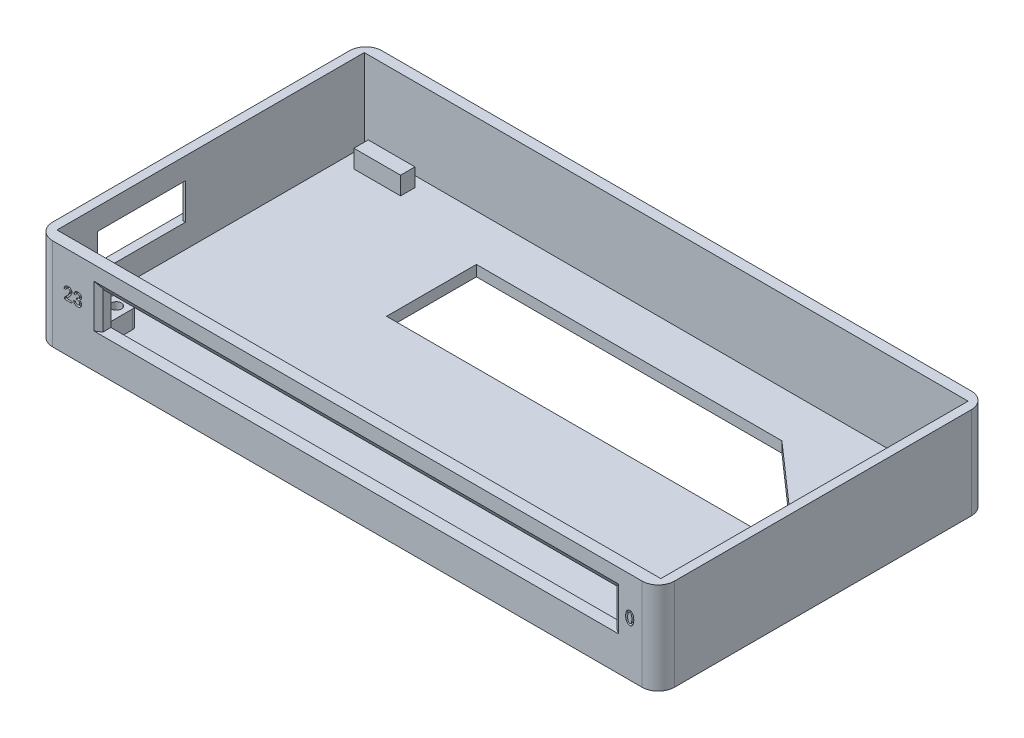
from build123d import *

# Parameters (mm, degrees)
BOSS_EXTRUDE2_DEPTH   = 4
BOSS_EXTRUDE2_2_DEPTH = 4
SKETCH3_W             = 176
SKETCH3_H             = 91.6
BOSS_EXTRUDE3_DEPTH   = 4
SKETCH6_W             = 168
SKETCH6_H             = 85.5
SKETCH6_W_2           = 160
SKETCH6_H_2           = 80
CUT_EXTRUDE2_DEPTH    = 1
SKETCH8_R             = 1.45
CUT_EXTRUDE3_DEPTH    = 100.527081742
SKETCH11_W            = 160
SKETCH11_H            = 80
CUT_EXTRUDE7_DEPTH    = 5
BOSS_EXTRUDE4_START   = 5
SKETCH12_R            = 1.45
BOSS_EXTRUDE4_DEPTH   = 5
BOSS_EXTRUDE5_START   = 5
SKETCH14_R            = 1.45
BOSS_EXTRUDE5_DEPTH   = 5
CUT_EXTRUDE8_DEPTH    = 5
SKETCH16_W            = 176
SKETCH16_H            = 91.6
SKETCH16_W_2          = 168
SKETCH16_H_2          = 85.5
BOSS_EXTRUDE6_DEPTH   = 30
FILLET2_START         = -1
FILLET2_DEPTH         = 6
SKETCH17_W            = 143
SKETCH17_H            = 10
CUT_EXTRUDE9_DEPTH    = 30
CHAMFER3_SIZE         = 1.5
CHAMFER3_SIZE2        = 0.97411139
SKETCH18_W            = 24.5
SKETCH18_H            = 10
CUT_EXTRUDE10_DEPTH   = 30
CHAMFER5_SIZE         = 1.5
CHAMFER5_SIZE2        = 0.97411139
CHAMFER6_SIZE         = 2
CHAMFER6_SIZE2        = 1.298815186
CUT_EXTRUDE11_DEPTH   = 0.6
CUT_EXTRUDE12_START   = -2.1
CUT_EXTRUDE12_DEPTH   = 3.1
SKETCH22_W            = 76
SKETCH22_H            = 3
BOSS_EXTRUDE8_DEPTH   = 20
CHAMFER7_SIZE         = 6.5
SKETCH23_R            = 1.55
CUT_EXTRUDE13_DEPTH   = 20
SKETCH26_W            = 37.191755128
SKETCH26_H            = 87.099263356
CUT_EXTRUDE14_DEPTH   = 20
SKETCH28_W            = 91.6
SKETCH28_H            = 38
CUT_EXTRUDE15_DEPTH   = 1.5
SKETCH29_W            = 91.6
SKETCH29_H            = 38
CUT_EXTRUDE16_DEPTH   = 1.5
CHAMFER8_SIZE         = 1.8
CHAMFER9_SIZE         = 1.5
FILLET3_START         = -5
FILLET3_DEPTH         = 40
CUT_EXTRUDE17_DEPTH   = 203.964948668
SKETCH30_W            = 4
SKETCH30_H            = 11
BOSS_EXTRUDE9_DEPTH   = 5
BOSS_EXTRUDE11_DEPTH  = 5
SKETCH33_W            = 13
SKETCH33_H            = 4
BOSS_EXTRUDE12_DEPTH  = 5


with BuildPart() as part:
    # Sketch2 → Boss-Extrude2 (new body)
    with BuildSketch(Plane(origin=(0, 0, 0), x_dir=(1, 0, 0), z_dir=(0, 1, 0))):
        Polygon((-80, 40), (-80, -40), (-75.05, -40), (80, -40), (80, 40), (75.05, 40), (0, 40), align=None)
        with BuildLine():
            ThreePointArc((-73.6, -35.05), (-74.024695167, -36.075304833), (-75.05, -36.5))
            ThreePointArc((-75.05, -36.5), (-76.075304833, -34.024695167), (-73.6, -35.05))
        make_face(mode=Mode.SUBTRACT)
        with BuildLine():
            ThreePointArc((76.5, 35.05), (74.024695167, 34.024695167), (75.05, 36.5))
            ThreePointArc((75.05, 36.5), (76.075304833, 36.075304833), (76.5, 35.05))
        make_face(mode=Mode.SUBTRACT)
    extrude(amount=BOSS_EXTRUDE2_DEPTH)



with BuildPart() as body_2:
    # Sketch2 → Boss-Extrude2 2 (new body)
    with BuildSketch(Plane(origin=(0, 0, 0), x_dir=(1, 0, 0), z_dir=(0, 1, 0))):
        Polygon((-88, 45.8), (-88, 40), (-88, -45.8), (-84, -45.8), (88, -45.8), (88, -40), (88, 40), (88, 45.8), (80, 45.8), align=None)
        Polygon((-84, -40), (-84, 40), (-84, 42.9), (84, 42.9), (84, -42.6), (-84, -42.6), align=None, mode=Mode.SUBTRACT)
    extrude(amount=BOSS_EXTRUDE2_2_DEPTH)


with BuildPart() as part_1:
    add(part.part)

    add(body_2.part)  # Boss-Extrude3 merges body 2
    # Sketch3 → Boss-Extrude3 (add)
    with BuildSketch(Plane(origin=(0, 0, 0), x_dir=(-1, 0, 0), z_dir=(0, -1, 0))):
        Rectangle(SKETCH3_W, SKETCH3_H)
    extrude(amount=BOSS_EXTRUDE3_DEPTH)

    # Sketch6 → Cut-Extrude2 (cut)
    with BuildSketch(Plane(origin=(0, 0, 0), x_dir=(1, 0, 0), z_dir=(0, 1, 0))):
        with Locations((0, 0.15)):
            Rectangle(SKETCH6_W, SKETCH6_H)
        Rectangle(SKETCH6_W_2, SKETCH6_H_2, mode=Mode.SUBTRACT)
    extrude(amount=-CUT_EXTRUDE2_DEPTH, mode=Mode.SUBTRACT)

    # Sketch8 → Cut-Extrude3 (cut, through all)
    with BuildSketch(Plane(origin=(0, 4, 0), x_dir=(1, 0, 0), z_dir=(0, 1, 0))):
        with Locations(Location((75.05, 35.05, 0), (0, 0, 270))):
            Circle(SKETCH8_R)
        with Locations(Location((-75.05, -35.05, 0), (0, 0, 270))):
            Circle(SKETCH8_R)
    extrude(amount=-CUT_EXTRUDE3_DEPTH, mode=Mode.SUBTRACT)

    # Sketch11 → Cut-Extrude7 (cut)
    with BuildSketch(Plane(origin=(0, 4, 0), x_dir=(1, 0, 0), z_dir=(0, 1, 0))):
        Rectangle(SKETCH11_W, SKETCH11_H)
    extrude(amount=-CUT_EXTRUDE7_DEPTH, mode=Mode.SUBTRACT)

    # Sketch12 → Boss-Extrude4 (add)
    with BuildSketch(Plane(origin=(0, -1, 0), x_dir=(1, 0, 0), z_dir=(0, 1, 0)).offset(BOSS_EXTRUDE4_START)):
        Polygon((80, 35.05), (80, 25.05), (65.05, 40), (75.05, 40), (80, 40), align=None)
        with Locations(Location((75.05, 35.05, 0), (0, 0, 270))):
            Circle(SKETCH12_R, mode=Mode.SUBTRACT)
    extrude(amount=-BOSS_EXTRUDE4_DEPTH)

    # Fillet1
    # a fillet whose section is not a circle: 2, 1 mm, written as the material it takes off along each edge
    with BuildSketch(Plane(origin=(65.05, 13.571067812, -40), x_dir=(1, 0, 0), z_dir=(0, -1, 0))) as fillet1_piece_1:
        with BuildLine():
            Bezier((3.414213562, 0), (0, 0), (2.707106781, 2.707106781), weights=[1, 0.382683432, 1])
            Line((2.707106781, 2.707106781), (0, 0))
            Line((0, 0), (3.414213562, 0))
        make_face()
    extrude(amount=14.571067812, mode=Mode.SUBTRACT)
    with BuildSketch(Plane(origin=(80, 13.571067812, -25.05), x_dir=(0, 0, -1), z_dir=(0, -1, 0))) as fillet1_piece_2:
        with BuildLine():
            Bezier((3.828427125, 0), (0, 0), (2.414213562, -2.414213562), weights=[1, 0.382683432, 1])
            Line((2.414213562, -2.414213562), (0, 0))
            Line((0, 0), (3.828427125, 0))
        make_face()
    extrude(amount=14.571067812, mode=Mode.SUBTRACT)

    # Sketch14 → Boss-Extrude5 (add)
    with BuildSketch(Plane(origin=(0, -1, 0), x_dir=(1, 0, 0), z_dir=(0, 1, 0)).offset(BOSS_EXTRUDE5_START)):
        Polygon((-75.05, -38.05), (-72.05, -38.05), (-72.05, -32.05), (-75.05, -32.05), (-78.05, -32.05), (-78.05, -38.05), align=None)
        with Locations(Location((-75.05, -35.05, 0), (0, 0, 270))):
            Circle(SKETCH14_R, mode=Mode.SUBTRACT)
    extrude(amount=-BOSS_EXTRUDE5_DEPTH)

    # Sketch15 → Cut-Extrude8 (cut)
    with BuildSketch(Plane(origin=(0, -1, 0), x_dir=(1, 0, 0), z_dir=(0, 1, 0))):
        Polygon((-39.95, 5.05), (70.05, 5.05), (70.05, 8.05), (45.05, 30.05), (-39.95, 30.05), align=None)
    extrude(amount=-CUT_EXTRUDE8_DEPTH, mode=Mode.SUBTRACT)

    # Sketch16 → Boss-Extrude6 (add)
    with BuildSketch(Plane(origin=(0, 4, 0), x_dir=(1, 0, 0), z_dir=(0, 1, 0))):
        Rectangle(SKETCH16_W, SKETCH16_H)
        with Locations((0, 0.15)):
            Rectangle(SKETCH16_W_2, SKETCH16_H_2, mode=Mode.SUBTRACT)
    extrude(amount=BOSS_EXTRUDE6_DEPTH)

    # Fillet2: read off the stored shape, not the designer's step
    # Fillet2 outline → Fillet2 (cut)
    with BuildSketch(Plane(origin=(0, 0, 0), x_dir=(1, 0, 0), z_dir=(0, 1, 0)).offset(FILLET2_START)):
        with BuildLine():
            Line((-78.05, -38.05), (-76.55, -38.05))
            add(Edge.make_bspline(
                [(-76.55, -38.05), (-78.05, -38.05), (-78.05, -36.55)],
                knots=[0, 0, 0, 1, 1, 1], degree=2, weights=[1, 0.707106781, 1]))
            Line((-78.05, -36.55), (-78.05, -38.05))
        make_face()
        with BuildLine():
            add(Edge.make_bspline(
                [(-72.05, -36.55), (-72.05, -38.05), (-73.55, -38.05)],
                knots=[0, 0, 0, 1, 1, 1], degree=2, weights=[1, 0.707106781, 1]))
            Line((-73.55, -38.05), (-72.05, -38.05))
            Line((-72.05, -38.05), (-72.05, -36.55))
        make_face()
        with BuildLine():
            Line((-78.05, -32.05), (-78.05, -33.55))
            add(Edge.make_bspline(
                [(-78.05, -33.55), (-78.05, -32.05), (-76.55, -32.05)],
                knots=[0, 0, 0, 1, 1, 1], degree=2, weights=[1, 0.707106781, 1]))
            Line((-76.55, -32.05), (-78.05, -32.05))
        make_face()
        with BuildLine():
            add(Edge.make_bspline(
                [(-73.55, -32.05), (-72.05, -32.05), (-72.05, -33.55)],
                knots=[0, 0, 0, 1, 1, 1], degree=2, weights=[1, 0.707106781, 1]))
            Line((-72.05, -33.55), (-72.05, -32.05))
            Line((-72.05, -32.05), (-73.55, -32.05))
        make_face()
    extrude(amount=FILLET2_DEPTH, mode=Mode.SUBTRACT)

    # Sketch17 → Cut-Extrude9 (cut)
    with BuildSketch(Plane(origin=(0, 0, 42.6), x_dir=(-1, 0, 0), z_dir=(0, 0, -1))):
        with Locations((-2.5, 10.6)):
            Rectangle(SKETCH17_W, SKETCH17_H)
    extrude(amount=-CUT_EXTRUDE9_DEPTH, mode=Mode.SUBTRACT)

    # Chamfer3
    chamfer3_edges = [part_1.edges().sort_by_distance(p)[0] for p in [
        (74, 10.6, 45.8),
        (-69, 10.6, 45.8),
    ]]
    chamfer3_side = [part_1.faces().sort_by_distance(p)[0] for p in [
        (-0.679916318, 16.19665272, 45.8),
    ]]
    chamfer(chamfer3_edges, length=CHAMFER3_SIZE, length2=CHAMFER3_SIZE2, reference=chamfer3_side[0])

    # Sketch18 → Cut-Extrude10 (cut)
    with BuildSketch(Plane(origin=(-84, 0, 0), x_dir=(0, 0, -1), z_dir=(1, 0, 0))):
        with Locations((-19.1, 10.6)):
            Rectangle(SKETCH18_W, SKETCH18_H)
    extrude(amount=-CUT_EXTRUDE10_DEPTH, mode=Mode.SUBTRACT)

    # Chamfer5
    chamfer5_edges = [part_1.edges().sort_by_distance(p)[0] for p in [
        (-88, 10.6, 31.35),
        (-88, 15.6, 19.1),
        (-88, 10.6, 6.85),
        (-88, 5.6, 19.1),
    ]]
    chamfer5_side = [part_1.faces().sort_by_distance(p)[0] for p in [
        (-88, 15.333147908, -1.446164782),
    ]]
    chamfer(chamfer5_edges, length=CHAMFER5_SIZE, length2=CHAMFER5_SIZE2, reference=chamfer5_side[0])

    # Chamfer6
    chamfer6_edges = [part_1.edges().sort_by_distance(p)[0] for p in [
        (2.5, 15.6, 45.8),
    ]]
    chamfer6_side = [part_1.faces().sort_by_distance(p)[0] for p in [
        (-0.698163734, 16.228768171, 45.8),
    ]]
    chamfer(chamfer6_edges, length=CHAMFER6_SIZE, length2=CHAMFER6_SIZE2, reference=chamfer6_side[0])

    # Sketch19 → Cut-Extrude11 (cut)
    # profile 1 of 3: a face of its own
    with BuildSketch(Plane.XY.offset(45.8)):
        with BuildLine():
            add(Edge.make_bspline(
                [(77.431641505, 11.221531607), (77.43357643, 11.26512312), (77.437350331, 11.35014456), (77.448165641, 11.473874385), (77.461438335, 11.590937319), (77.478432791, 11.701027702), (77.499689684, 11.80420533), (77.523396716, 11.900627725), (77.551078862, 11.990251282), (77.592915667, 12.099487535), (77.654167363, 12.226226054), (77.743211541, 12.365669844), (77.847804955, 12.490928896), (77.945851912, 12.584422263), (78.031980166, 12.64999316), (78.101271855, 12.693011789), (78.175082517, 12.729070093), (78.252933125, 12.758241099), (78.334469379, 12.78187018), (78.420480517, 12.798234043), (78.510680747, 12.807889904), (78.603816552, 12.810675296), (78.697560683, 12.807311361), (78.789108916, 12.791560469), (78.877644403, 12.767732653), (78.962862232, 12.733737227), (79.044495727, 12.689860047), (79.122331029, 12.635883542), (79.196908262, 12.572345628), (79.267631374, 12.500007124), (79.332816228, 12.420308341), (79.394536633, 12.33747678), (79.447245242, 12.248646707), (79.495978713, 12.15733764), (79.536900763, 12.061022568), (79.57374688, 11.961371674), (79.601452433, 11.856475805), (79.633107673, 11.709930138), (79.659504248, 11.516023129), (79.679046567, 11.271239792), (79.684649233, 11.010649578), (79.677748612, 10.785358703), (79.665317677, 10.602800695), (79.651274761, 10.469940169), (79.632090268, 10.34350075), (79.610492568, 10.222819621), (79.581237195, 10.108812005), (79.549347361, 10.000309354), (79.512669483, 9.89812269), (79.471196391, 9.802196245), (79.42521713, 9.712303626), (79.371178342, 9.629813972), (79.311316995, 9.554149393), (79.245436538, 9.484927967), (79.172898583, 9.423062863), (79.093735288, 9.368213236), (79.008442683, 9.320065294), (78.918356372, 9.278891015), (78.824975635, 9.246874317), (78.731209933, 9.223968701), (78.637745912, 9.211956231), (78.544797862, 9.209379642), (78.452373912, 9.217928518), (78.360383425, 9.236006435), (78.269397335, 9.264952167), (78.18001034, 9.303013401), (78.095092091, 9.348781935), (78.014938573, 9.397381119), (77.941717148, 9.450008081), (77.875642382, 9.506785149), (77.814888738, 9.565682765), (77.76231625, 9.62965789), (77.715038779, 9.696157861), (77.664226011, 9.79108427), (77.608820149, 9.912753792), (77.552652589, 10.062521332), (77.50542401, 10.215077062), (77.476303064, 10.346004878), (77.456759623, 10.455196378), (77.446083561, 10.544528256), (77.436791944, 10.640684817), (77.43117952, 10.743695443), (77.427457648, 10.853397114), (77.425817538, 10.969868283), (77.427572012, 11.093345958), (77.430258364, 11.177963794), (77.431641505, 11.221531607)],
                knots=[0, 0, 0, 0, 1.155683737, 2.254060208, 3.289083543, 4.275996313, 5.203501349, 6.078654409, 6.905254226, 7.686259293, 9.175480835, 10.625362805, 12.057229327, 13.488373587, 14.203415217, 14.921281653, 15.645099004, 16.375632236, 17.120922195, 17.891035316, 18.691651653, 19.521200253, 20.357904477, 21.171386448, 21.975949703, 22.782724614, 23.595854961, 24.425642192, 25.286833663, 26.187407587, 27.101221321, 28.01267284, 28.920448357, 29.83426209, 30.752254981, 31.690137756, 32.645956503, 33.622989927, 35.660431351, 37.823041574, 40.125301952, 42.560703798, 43.790833543, 44.971618186, 46.098231705, 47.178004829, 48.217249088, 49.214075701, 50.172927633, 51.090920525, 51.980953586, 52.843803822, 53.698431003, 54.533503556, 55.370943622, 56.21918914, 57.080584939, 57.962199368, 58.839009869, 59.691678548, 60.51441043, 61.330511274, 62.149625556, 62.967853103, 63.80909348, 64.673955469, 65.537417366, 66.362178841, 67.155619074, 67.922554923, 68.668316995, 69.393591698, 70.113049857, 70.825595159, 72.241347001, 73.651946307, 75.059845092, 76.467821999, 77.201720101, 77.997292311, 78.850038385, 79.760306499, 80.729291287, 81.757490875, 82.845382708, 84, 84, 84, 84], degree=3))
        make_face()
        with BuildLine():
            add(Edge.make_bspline(
                [(77.99281343, 11.336470435), (77.988497402, 11.291670559), (77.980019645, 11.203672433), (77.972779075, 11.073126615), (77.968994895, 10.946324975), (77.972876514, 10.823311216), (77.978698916, 10.703910752), (77.991891017, 10.588660406), (78.009204322, 10.476891741), (78.030405217, 10.3697003), (78.056845097, 10.268549411), (78.08588755, 10.175026938), (78.117311133, 10.089212159), (78.152300598, 10.012018562), (78.190873263, 9.942969682), (78.23208236, 9.882143482), (78.275599498, 9.828517157), (78.323079537, 9.784430923), (78.371922219, 9.748021258), (78.421666872, 9.719970917), (78.471667561, 9.700002249), (78.522085132, 9.688393743), (78.573127948, 9.685319441), (78.62446593, 9.690999622), (78.676352831, 9.703582511), (78.727346294, 9.726023695), (78.777110185, 9.755169154), (78.825224623, 9.790438403), (78.868457976, 9.834004008), (78.909460332, 9.883096752), (78.946943417, 9.939117806), (78.98140721, 10.001415695), (79.01236335, 10.070583858), (79.049095095, 10.172354346), (79.086964108, 10.308419822), (79.120121752, 10.479217444), (79.139487664, 10.658141372), (79.144958513, 10.842123183), (79.143002319, 11.025760823), (79.136783188, 11.203569858), (79.128137733, 11.372945629), (79.115283502, 11.534002025), (79.094943476, 11.687219625), (79.059495056, 11.831883578), (79.009899877, 11.967437498), (78.957405612, 12.072724212), (78.909545193, 12.149067609), (78.871897498, 12.199629176), (78.831377467, 12.241971034), (78.789799062, 12.278526495), (78.745246155, 12.306285159), (78.69868162, 12.326918124), (78.650166279, 12.340752877), (78.599971218, 12.346591151), (78.549333723, 12.345144474), (78.499435782, 12.336050602), (78.450461876, 12.319271119), (78.40297959, 12.293899353), (78.356210848, 12.261242305), (78.310316149, 12.221263571), (78.265788856, 12.173234847), (78.222289593, 12.117658871), (78.180444883, 12.053500484), (78.143405522, 11.979105826), (78.108436304, 11.895779158), (78.079547421, 11.802042459), (78.050759212, 11.69969276), (78.028650699, 11.58698689), (78.007769006, 11.46509147), (77.997915713, 11.380351114), (77.99281343, 11.336470435)],
                knots=[0, 0, 0, 0, 1.452167118, 2.852418281, 4.218396657, 5.543984443, 6.822765002, 8.074713207, 9.284974616, 10.471920825, 11.598846593, 12.656922723, 13.631044256, 14.5458853, 15.388812111, 16.179953707, 16.914519434, 17.61197034, 18.264888641, 18.876285569, 19.449485096, 19.996394829, 20.5387489, 21.091123116, 21.657504393, 22.254856762, 22.881287043, 23.51641241, 24.173517405, 24.856351225, 25.578003657, 26.344795291, 27.151303469, 28.020468383, 29.834110771, 31.702512638, 33.62906866, 35.634339229, 37.638355807, 39.554512999, 41.375197988, 43.110520322, 44.767505055, 46.356911141, 47.906083104, 49.416608493, 50.142950543, 50.812019548, 51.446476334, 52.031067659, 52.593805832, 53.132839029, 53.670052187, 54.215287947, 54.756919201, 55.298972215, 55.845822252, 56.420500712, 57.030186539, 57.683154838, 58.380605745, 59.14033988, 59.958423015, 60.847419337, 61.818318184, 62.871135914, 64.010020701, 65.247701822, 66.574791078, 68, 68, 68, 68], degree=3))
        make_face(mode=Mode.SUBTRACT)
    # profile 2 of 3: a face of its own
    with BuildSketch(Plane.XY.offset(45.8)):
        with BuildLine():
            add(Edge.make_bspline(
                [(-78.761229815, 9.332539261), (-78.758833834, 9.358675042), (-78.754044825, 9.410914393), (-78.736002189, 9.487226914), (-78.712103276, 9.561925001), (-78.679660378, 9.633867976), (-78.639455965, 9.703439138), (-78.591801662, 9.770466953), (-78.536838376, 9.835407523), (-78.472903956, 9.897653295), (-78.403547622, 9.962698376), (-78.331204601, 10.036175309), (-78.255065737, 10.117816241), (-78.174723575, 10.207276078), (-78.090178591, 10.304578064), (-78.002022819, 10.410225473), (-77.909460917, 10.523997353), (-77.814738897, 10.642706095), (-77.722493118, 10.762108372), (-77.637092857, 10.876994247), (-77.559404891, 10.983880549), (-77.491578853, 11.08430538), (-77.432286372, 11.177289435), (-77.380933927, 11.262691355), (-77.338511558, 11.340762788), (-77.295417901, 11.432845649), (-77.255505209, 11.538694559), (-77.222407781, 11.657489701), (-77.208613112, 11.766422287), (-77.213233433, 11.865552791), (-77.235895284, 11.954736169), (-77.271009474, 12.036549826), (-77.323593938, 12.108397775), (-77.387842413, 12.171089048), (-77.46094826, 12.221936313), (-77.540766068, 12.256927503), (-77.625071381, 12.27373946), (-77.712255638, 12.272184362), (-77.799950447, 12.255920023), (-77.887515084, 12.227050851), (-77.973647096, 12.184120748), (-78.043638826, 12.138403163), (-78.098535168, 12.094421978), (-78.137555202, 12.053685322), (-78.175785549, 12.008244773), (-78.212160061, 11.956442026), (-78.246482707, 11.898524435), (-78.279250607, 11.834663037), (-78.311266592, 11.765139492), (-78.330056589, 11.716073393), (-78.339787445, 11.690663322)],
                knots=[0, 0, 0, 0, 0.812458924, 1.623916483, 2.423975288, 3.240316732, 4.06429525, 4.910522612, 5.785959881, 6.696898735, 7.673935193, 8.733053017, 9.891570135, 11.133511023, 12.459304827, 13.886182053, 15.39761038, 17.004732369, 18.59270287, 20.073435524, 21.441110431, 22.687384008, 23.828405559, 24.858552289, 25.775225142, 26.580685755, 28.007647397, 29.276407073, 30.393989518, 31.396581679, 32.332049695, 33.231912994, 34.138577372, 35.071531117, 36.003612958, 36.883031381, 37.753604976, 38.646109437, 39.568611226, 40.508543129, 41.494232884, 42.542490605, 43.093985918, 43.670208311, 44.28726261, 44.933214355, 45.629294362, 46.372086978, 47.156945713, 48, 48, 48, 48], degree=3))
            Line((-78.339787445, 11.690663322), (-78.840860637, 11.759025631))
            add(Edge.make_bspline(
                [(-78.840860637, 11.759025631), (-78.827037425, 11.801503651), (-78.800304181, 11.883653535), (-78.754044121, 12.000626431), (-78.705323793, 12.108270422), (-78.65404391, 12.206762121), (-78.598899959, 12.294878983), (-78.54178744, 12.374015244), (-78.481004635, 12.443025204), (-78.417419098, 12.503238831), (-78.350090566, 12.554596532), (-78.280771074, 12.60046644), (-78.208010796, 12.639650314), (-78.132832621, 12.673120206), (-78.054100618, 12.69897352), (-77.972977578, 12.720480759), (-77.88845454, 12.73471328), (-77.830997076, 12.739311593), (-77.801903779, 12.741639926)],
                knots=[0, 0, 0, 0, 1.394098335, 2.696100676, 3.923911207, 5.081226417, 6.159164946, 7.166006065, 8.124123657, 9.025463167, 9.894746418, 10.764099952, 11.617494181, 12.471460966, 13.329175664, 14.201265779, 15.089220005, 16, 16, 16, 16], degree=3))
            add(Edge.make_bspline(
                [(-77.801903779, 12.741639926), (-77.767620521, 12.744366545), (-77.700126559, 12.74973448), (-77.600195375, 12.749541431), (-77.503801239, 12.742871007), (-77.409902303, 12.729585285), (-77.317379487, 12.706954092), (-77.224809718, 12.673287684), (-77.131742803, 12.628767868), (-77.038845855, 12.573570576), (-76.949340625, 12.506725385), (-76.868152769, 12.425477547), (-76.797532098, 12.330535975), (-76.73648839, 12.224021935), (-76.688516842, 12.105366293), (-76.658458283, 11.975136381), (-76.648287173, 11.834287932), (-76.652963992, 11.710702539), (-76.667217669, 11.606053382), (-76.687455222, 11.522595085), (-76.714388354, 11.435111037), (-76.750463846, 11.344162263), (-76.792814169, 11.24876768), (-76.844804632, 11.15029997), (-76.903104991, 11.047220086), (-76.97133727, 10.939151629), (-77.050523237, 10.822101403), (-77.146034112, 10.695037797), (-77.255602845, 10.553281404), (-77.382051871, 10.399324476), (-77.523189214, 10.231255941), (-77.68154494, 10.051634809), (-77.853917232, 9.857230332), (-77.975952633, 9.724969652), (-78.039293777, 9.656321188)],
                knots=[0, 0, 0, 0, 0.767290437, 1.510576088, 2.227684762, 2.922405895, 3.624527997, 4.349326193, 5.116759085, 5.923767319, 6.757595258, 7.603269073, 8.477329005, 9.390943466, 10.336361207, 11.323254094, 12.360540583, 13.479157188, 14.077452175, 14.714578673, 15.39335949, 16.11880377, 16.896766127, 17.721631154, 18.602666877, 19.539239205, 20.57313278, 21.755702502, 23.085980454, 24.571542942, 26.201589399, 27.983822824, 29.915447008, 32, 32, 32, 32], degree=3))
            Line((-78.039293777, 9.656321188), (-76.60593898, 9.656321188))
            Line((-76.60593898, 9.656321188), (-76.60593898, 9.201824515))
            Line((-76.60593898, 9.201824515), (-78.761229815, 9.201824515))
            Line((-78.761229815, 9.201824515), (-78.761229815, 9.332539261))
        make_face()
    # profile 3 of 3: a face of its own
    with BuildSketch(Plane.XY.offset(45.8)):
        with BuildLine():
            Line((-76.156700946, 10.145374633), (-75.673657375, 10.213736943))
            add(Edge.make_bspline(
                [(-75.673657375, 10.213736943), (-75.657371136, 10.166522453), (-75.626431679, 10.076827666), (-75.566706997, 9.95431768), (-75.49913792, 9.850799786), (-75.436146602, 9.777323432), (-75.380648686, 9.730291939), (-75.337877551, 9.699972418), (-75.292526386, 9.674989079), (-75.244775715, 9.655497844), (-75.194742316, 9.640325994), (-75.142434109, 9.629834619), (-75.087566753, 9.624558582), (-75.031494604, 9.624729996), (-74.975276337, 9.629557011), (-74.920987587, 9.641181825), (-74.868841323, 9.657347646), (-74.819848035, 9.680240457), (-74.773423882, 9.708339286), (-74.729654179, 9.742211335), (-74.689183598, 9.782565992), (-74.651146861, 9.827232914), (-74.616829761, 9.875675771), (-74.587343766, 9.926612602), (-74.56408287, 9.979975659), (-74.545139499, 10.034662814), (-74.531616723, 10.091280187), (-74.52333094, 10.149373914), (-74.520394029, 10.209213515), (-74.522623767, 10.270041262), (-74.530061845, 10.330087133), (-74.541991403, 10.387427932), (-74.558517264, 10.441389229), (-74.580227183, 10.491898799), (-74.607647322, 10.53892593), (-74.639948195, 10.582472088), (-74.677014571, 10.622460824), (-74.719024646, 10.65940023), (-74.768273205, 10.692532652), (-74.824686841, 10.724522983), (-74.89065119, 10.752209675), (-74.964080444, 10.779660374), (-75.046360647, 10.803194395), (-75.136598592, 10.824912211), (-75.235337181, 10.844522042), (-75.304254313, 10.855064634), (-75.340109403, 10.860549563)],
                knots=[0, 0, 0, 0, 2.21924101, 4.215958907, 6.040992817, 7.7053072, 8.495104242, 9.27040691, 10.032811151, 10.791629887, 11.559461714, 12.354265444, 13.159682002, 14.005854253, 14.844521828, 15.663370554, 16.46971005, 17.266772081, 18.061107775, 18.878441235, 19.720869505, 20.597620065, 21.484212586, 22.356995289, 23.209370964, 24.068482601, 24.927233434, 25.793243368, 26.673943911, 27.587530034, 28.496218265, 29.360938961, 30.188521517, 31.001368487, 31.799596098, 32.603472073, 33.407116705, 34.21988742, 35.084608115, 36.041665591, 37.098677481, 38.261085067, 39.525891865, 40.900414571, 42.387397877, 44, 44, 44, 44], degree=3))
            Line((-75.340109403, 10.860549563), (-75.340109403, 11.204614814))
            add(Edge.make_bspline(
                [(-75.340109403, 11.204614814), (-75.304497079, 11.208201907), (-75.235780542, 11.215123462), (-75.137281396, 11.231908349), (-75.046933077, 11.251955954), (-74.964959429, 11.275640817), (-74.89138444, 11.303642542), (-74.825971003, 11.334751737), (-74.768573685, 11.370058757), (-74.720421386, 11.410595028), (-74.678190749, 11.453424997), (-74.644115224, 11.500692104), (-74.613761734, 11.549547298), (-74.591740636, 11.602489176), (-74.574758976, 11.658053272), (-74.564529857, 11.716580662), (-74.559998592, 11.778238333), (-74.561713782, 11.841596759), (-74.568503232, 11.904699669), (-74.583270868, 11.96419979), (-74.602334525, 12.019846917), (-74.62904907, 12.070471205), (-74.661580484, 12.116707515), (-74.700299395, 12.158637965), (-74.74571068, 12.195171885), (-74.795879722, 12.227322152), (-74.849062253, 12.253953798), (-74.903761938, 12.27434257), (-74.958504009, 12.28917848), (-75.014146853, 12.295607017), (-75.069758195, 12.296324897), (-75.126135927, 12.291459504), (-75.18229213, 12.277868783), (-75.239549769, 12.259853415), (-75.295753709, 12.230652376), (-75.350916943, 12.190061465), (-75.402790274, 12.136006077), (-75.453626772, 12.070536975), (-75.501766408, 11.992816419), (-75.5495124, 11.903389662), (-75.594880632, 11.801608401), (-75.621988042, 11.728639063), (-75.636095666, 11.690663322)],
                knots=[0, 0, 0, 0, 1.544655138, 2.980523068, 4.310085624, 5.538041238, 6.660247671, 7.704521267, 8.661264608, 9.559490368, 10.415691744, 11.250192615, 12.06957472, 12.892798034, 13.716943409, 14.573554092, 15.451518492, 16.381382685, 17.306522728, 18.184819779, 19.022465106, 19.839562419, 20.646298093, 21.457079029, 22.294445327, 23.155002605, 24.02514668, 24.85635064, 25.671730158, 26.466794538, 27.266766995, 28.070237254, 28.901511498, 29.756073687, 30.655274543, 31.621678213, 32.699429876, 33.87785843, 35.19439462, 36.640317884, 38.251506453, 40, 40, 40, 40], degree=3))
            Line((-75.636095666, 11.690663322), (-76.116885535, 11.759025631))
            add(Edge.make_bspline(
                [(-76.116885535, 11.759025631), (-76.106498499, 11.793458872), (-76.086086928, 11.861123653), (-76.049633632, 11.958339081), (-76.011497396, 12.050521498), (-75.970117636, 12.137030249), (-75.925899444, 12.218395488), (-75.878352059, 12.2941228), (-75.829187881, 12.365381305), (-75.775293605, 12.430097791), (-75.718500632, 12.490170109), (-75.655708976, 12.542993932), (-75.587540624, 12.588964601), (-75.514655495, 12.62881812), (-75.436704854, 12.662159464), (-75.353547214, 12.688160081), (-75.265454924, 12.708695436), (-75.1731545, 12.721535162), (-75.079824905, 12.729098264), (-74.987749784, 12.730426034), (-74.898149241, 12.726987509), (-74.811026561, 12.717226388), (-74.7266088, 12.701573915), (-74.64516167, 12.679421448), (-74.565929873, 12.652513851), (-74.489751996, 12.619722715), (-74.418049656, 12.581537744), (-74.351294099, 12.539340915), (-74.290509468, 12.492774512), (-74.23511306, 12.442296973), (-74.186057712, 12.387142818), (-74.142927246, 12.327527221), (-74.106339366, 12.263278985), (-74.074590994, 12.195805536), (-74.04955593, 12.125486812), (-74.029287677, 12.05357235), (-74.017232508, 11.979718725), (-74.00910878, 11.904718021), (-74.008801054, 11.828045688), (-74.013932448, 11.750194037), (-74.025613515, 11.670671458), (-74.042242957, 11.590292564), (-74.066805471, 11.510459866), (-74.100638986, 11.433314413), (-74.144708882, 11.360187589), (-74.197869507, 11.29066063), (-74.259898868, 11.224385668), (-74.330744029, 11.161236673), (-74.410947644, 11.101407414), (-74.469364248, 11.065907365), (-74.499478366, 11.047606872)],
                knots=[0, 0, 0, 0, 1.264664845, 2.485193632, 3.649815651, 4.772554787, 5.8564488, 6.904873161, 7.916470085, 8.89869285, 9.86418825, 10.820480558, 11.778069864, 12.751606364, 13.738084608, 14.754768136, 15.81232734, 16.915902724, 18.029136064, 19.103794268, 20.152810375, 21.180875043, 22.184503936, 23.16940822, 24.147039655, 25.125424593, 26.08285187, 27.001536872, 27.899944066, 28.772641487, 29.633525806, 30.491521848, 31.355643938, 32.230383382, 33.110780052, 33.97826197, 34.85428633, 35.739428161, 36.629028292, 37.54707979, 38.481255219, 39.453795203, 40.431585318, 41.413492129, 42.408894417, 43.427064688, 44.486456052, 45.596758908, 46.761114469, 48, 48, 48, 48], degree=3))
            add(Edge.make_bspline(
                [(-74.499478366, 11.047606872), (-74.477823072, 11.038622768), (-74.435063026, 11.020882962), (-74.373353297, 10.989506927), (-74.316672589, 10.951207312), (-74.261825895, 10.910049811), (-74.211235608, 10.863346291), (-74.1629751, 10.812582078), (-74.119319476, 10.756347502), (-74.078440898, 10.696150904), (-74.041993963, 10.631751115), (-74.012737385, 10.561809133), (-73.989516512, 10.487639399), (-73.972899492, 10.408904164), (-73.963545745, 10.325912982), (-73.959581856, 10.238540984), (-73.963151544, 10.146695867), (-73.971720036, 10.051766668), (-73.987453626, 9.956456913), (-74.013538147, 9.864296045), (-74.047004516, 9.775906015), (-74.090477844, 9.692159074), (-74.141585019, 9.612301775), (-74.201246149, 9.53657725), (-74.270323245, 9.466077676), (-74.346065713, 9.399490842), (-74.428390793, 9.340365258), (-74.512999833, 9.287224338), (-74.601056976, 9.243211175), (-74.691948764, 9.208142864), (-74.785337401, 9.180606766), (-74.881561752, 9.163069286), (-74.980228514, 9.151956427), (-75.0807731, 9.151164382), (-75.180741246, 9.156749516), (-75.277873726, 9.170537577), (-75.371487789, 9.190466741), (-75.461043319, 9.218624679), (-75.547260575, 9.252958569), (-75.629307662, 9.295676979), (-75.708520966, 9.34407872), (-75.782972958, 9.400969687), (-75.853591072, 9.464462477), (-75.916425719, 9.537890612), (-75.97315614, 9.618975852), (-76.023582167, 9.707951046), (-76.067368373, 9.805525427), (-76.103451141, 9.911630159), (-76.134922124, 10.025394976), (-76.149312129, 10.104669597), (-76.156700946, 10.145374633)],
                knots=[0, 0, 0, 0, 0.768138437, 1.516748496, 2.263152186, 3.006528408, 3.761540595, 4.516106847, 5.299044825, 6.090959292, 6.899030075, 7.718886061, 8.570043758, 9.442217001, 10.351016586, 11.303647327, 12.305160512, 13.359969178, 14.42557193, 15.464691966, 16.493198161, 17.516980995, 18.550254108, 19.59586457, 20.669303552, 21.779974798, 22.895936785, 23.986546903, 25.050632422, 26.115666464, 27.175060169, 28.23550182, 29.31644003, 30.424198195, 31.525587691, 32.594249943, 33.6354733, 34.657940217, 35.666553097, 36.671990709, 37.685198356, 38.704235937, 39.737964997, 40.790761429, 41.862851258, 42.976186133, 44.136653187, 45.361383937, 46.645153232, 48, 48, 48, 48], degree=3))
        make_face()
    extrude(amount=-CUT_EXTRUDE11_DEPTH, mode=Mode.SUBTRACT)

    # Cut-Extrude12: read off the stored shape, not the designer's step
    # Cut-Extrude12 outline → Cut-Extrude12 (cut)
    with BuildSketch(Plane.ZY.offset(88).offset(CUT_EXTRUDE12_START)):
        Polygon((11.191185887, 17.876866668), (12.402926604, 21.376866668), (11.801188033, 21.376866668), (11.026082456, 19.138732286), (10.808807694, 21.376866668), (10.188288269, 21.376866668), (8.976547552, 17.876866668), (9.579037357, 17.876866668), (10.349506832, 20.101614203), (10.566159057, 17.876866668), align=None)
        Polygon((26.963751015, 17.876866668), (29.17838935, 17.876866668), (29.342909633, 18.350895429), (27.730761103, 18.350895429), (28.777981537, 21.376866668), (28.175491732, 21.376866668), align=None)
    extrude(amount=CUT_EXTRUDE12_DEPTH, mode=Mode.SUBTRACT)

    # Sketch22 → Boss-Extrude8 (add)
    with BuildSketch(Plane(origin=(88, 0, 0), x_dir=(0, 0, -1), z_dir=(1, 0, 0))):
        with Locations((0, 5.5)):
            Rectangle(SKETCH22_W, SKETCH22_H)
    extrude(amount=BOSS_EXTRUDE8_DEPTH)

    # Chamfer7
    chamfer7_edges = [part_1.edges().sort_by_distance(p)[0] for p in [
        (108, 5.5, -38),
        (108, 5.5, 38),
    ]]
    chamfer(chamfer7_edges, length=CHAMFER7_SIZE)

    # Sketch23 → Cut-Extrude13 (cut)
    with BuildSketch(Plane.XZ.offset(-4)):
        with Locations(Location((98, 31.5, 0), (0, 0, 270))):
            Circle(SKETCH23_R)
        with Locations(Location((98, -31.5, 0), (0, 0, 270))):
            Circle(SKETCH23_R)
        with BuildLine():
            Line((99.5, 15.5), (99.5, 3))
            ThreePointArc((99.5, 3), (98, 1.5), (96.5, 3))
            Line((96.5, 3), (96.5, 15.5))
            ThreePointArc((96.5, 15.5), (98, 17), (99.5, 15.5))
        make_face()
    extrude(amount=-CUT_EXTRUDE13_DEPTH, mode=Mode.SUBTRACT)

    # Sketch26 → Cut-Extrude14 (cut)
    with BuildSketch(Plane(origin=(0, 7, 0), x_dir=(1, 0, 0), z_dir=(0, 1, 0))):
        with Locations((106.595877564, 5.549631678)):
            Rectangle(SKETCH26_W, SKETCH26_H)
    extrude(amount=-CUT_EXTRUDE14_DEPTH, mode=Mode.SUBTRACT)

    # Sketch28 → Cut-Extrude15 (cut)
    with BuildSketch(Plane(origin=(88, 0, 0), x_dir=(0, 0, -1), z_dir=(1, 0, 0))):
        with Locations((0, 15)):
            Rectangle(SKETCH28_W, SKETCH28_H)
    extrude(amount=-CUT_EXTRUDE15_DEPTH, mode=Mode.SUBTRACT)

    # Sketch29 → Cut-Extrude16 (cut)
    with BuildSketch(Plane.ZY.offset(88)):
        with Locations((0, 15)):
            Rectangle(SKETCH29_W, SKETCH29_H)
    extrude(amount=-CUT_EXTRUDE16_DEPTH, mode=Mode.SUBTRACT)

    # Chamfer8
    chamfer8_edges = [part_1.edges().sort_by_distance(p)[0] for p in [
        (-86.5, 10.6, 6.85),
        (-86.5, 10.6, 31.35),
    ]]
    chamfer(chamfer8_edges, length=CHAMFER8_SIZE)

    # Chamfer9
    chamfer9_edges = [part_1.edges().sort_by_distance(p)[0] for p in [
        (-86.5, 15.6, 19.1),
    ]]
    chamfer(chamfer9_edges, length=CHAMFER9_SIZE)

    # Fillet3: read off the stored shape, not the designer's step
    # Fillet3 outline → Fillet3 (cut)
    with BuildSketch(Plane(origin=(0, 0, 0), x_dir=(1, 0, 0), z_dir=(0, 1, 0)).offset(FILLET3_START)):
        with BuildLine():
            add(Edge.make_bspline(
                [(-86.5, -41.3), (-86.5, -45.8), (-82, -45.8)],
                knots=[0, 0, 0, 1, 1, 1], degree=2, weights=[1, 0.707106781, 1]))
            Line((-86.5, -41.3), (-86.5, -45.8))
            Line((-86.5, -45.8), (-82, -45.8))
        make_face()
        with BuildLine():
            Line((-86.5, 45.8), (-86.5, 41.3))
            add(Edge.make_bspline(
                [(-86.5, 41.3), (-86.5, 45.8), (-82, 45.8)],
                knots=[0, 0, 0, 1, 1, 1], degree=2, weights=[1, 0.707106781, 1]))
            Line((-82, 45.8), (-86.5, 45.8))
        make_face()
        with BuildLine():
            add(Edge.make_bspline(
                [(86.5, -41.3), (86.5, -45.8), (82, -45.8)],
                knots=[0, 0, 0, 1, 1, 1], degree=2, weights=[1, 0.707106781, 1]))
            Line((82, -45.8), (86.5, -45.8))
            Line((86.5, -45.8), (86.5, -41.3))
        make_face()
        with BuildLine():
            Line((86.5, 45.8), (82, 45.8))
            add(Edge.make_bspline(
                [(86.5, 41.3), (86.5, 45.8), (82, 45.8)],
                knots=[0, 0, 0, 1, 1, 1], degree=2, weights=[1, 0.707106781, 1]))
            Line((86.5, 41.3), (86.5, 45.8))
        make_face()
    extrude(amount=FILLET3_DEPTH, mode=Mode.SUBTRACT)

    # 3DSketch1 → Cut-Extrude17 (cut, through all)
    with BuildSketch(Plane(origin=(91.630034631, 21.6, 48.056811636), x_dir=(-0.8840960491089728, 0, -0.46730522782214284), z_dir=(0, 1, 0))):
        Polygon((0, 0), (162.604584289, 85.947643791), (208.033792239, 0), (45.42920795, -85.947643791), align=None)
    extrude(amount=CUT_EXTRUDE17_DEPTH, mode=Mode.SUBTRACT)

    # Sketch30 → Boss-Extrude9 (add)
    with BuildSketch(Plane(origin=(0, -1, 0), x_dir=(1, 0, 0), z_dir=(0, 1, 0))):
        with Locations((78, -37.1)):
            Rectangle(SKETCH30_W, SKETCH30_H)
    extrude(amount=BOSS_EXTRUDE9_DEPTH)

    # Sketch32 → Boss-Extrude11 (add)
    with BuildSketch(Plane(origin=(0, -1, 0), x_dir=(1, 0, 0), z_dir=(0, 1, 0))):
        with BuildLine():
            Line((-72.05, -42.6), (-72.05, -36.55))
            add(Edge.make_bspline(
                [(-72.05, -36.55), (-72.05, -38.05), (-73.55, -38.05)],
                knots=[0, 0, 0, 1, 1, 1], degree=2, weights=[1, 0.707106781, 1]))
            Line((-73.55, -38.05), (-76.55, -38.05))
            add(Edge.make_bspline(
                [(-76.55, -38.05), (-77.79808359, -38.05), (-78.025, -36.822717803)],
                knots=[0, 0, 0, 0.875101753, 0.875101753, 0.875101753], degree=2, weights=[1, 0.743688631, 0.935974319]))
            Line((-78.025, -36.822717803), (-78.025, -42.6))
            Line((-78.025, -42.6), (-72.05, -42.6))
        make_face()
    extrude(amount=BOSS_EXTRUDE11_DEPTH)

    # Sketch33 → Boss-Extrude12 (add)
    with BuildSketch(Plane(origin=(0, -1, 0), x_dir=(1, 0, 0), z_dir=(0, 1, 0))):
        with Locations((-73.5, 38)):
            Rectangle(SKETCH33_W, SKETCH33_H)
    extrude(amount=BOSS_EXTRUDE12_DEPTH)


solid = part_1.part
